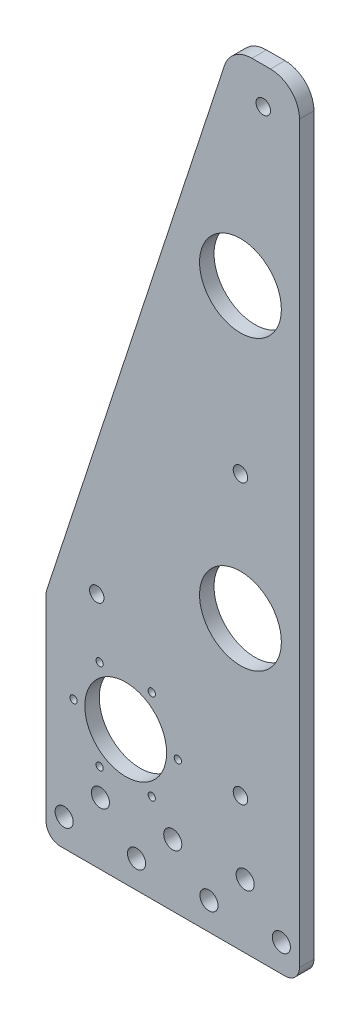
from build123d import *

# Parameters (mm, degrees)
SKETCH1_R           = 14.351
SKETCH1_R_2         = 2.54
SKETCH1_R_3         = 3.175
SKETCH1_R_4         = 1.27
BOSS_EXTRUDE1_DEPTH = 5.08
SKETCH2_R           = 2.54
BOSS_EXTRUDE2_DEPTH = 5.08
SKETCH3_R           = 2.54
CUT_EXTRUDE1_DEPTH  = 288.202574675


with BuildPart() as part:
    # Sketch1 → Boss-Extrude1 (new body)
    with BuildSketch(Plane.XY):
        with BuildLine():
            Line((88.9, 212.09), (88.9, 5.08))
            ThreePointArc((88.9, 5.08), (87.412102448, 1.487897552), (83.82, 0))
            Line((83.82, 0), (5.08, 0))
            ThreePointArc((5.08, 0), (1.487897552, 1.487897552), (0, 5.08))
            Line((0, 5.08), (0, 73.969993162))
            ThreePointArc((0, 73.969993162), (0.063384098, 74.769971217), (0.25195468, 75.549986324))
            Line((0.25195468, 75.549986324), (45.969223296, 215.249986324))
            ThreePointArc((45.969223296, 215.249986324), (49.662087504, 220.315906061), (55.625313935, 222.25))
            Line((55.625313935, 222.25), (78.74, 222.25))
            ThreePointArc((78.74, 222.25), (85.924204897, 219.274204897), (88.9, 212.09))
        make_face()
        with Locations((68.199, 201.93)):
            Circle(SKETCH1_R, mode=Mode.SUBTRACT)
        with Locations((68.199, 100.838)):
            Circle(SKETCH1_R, mode=Mode.SUBTRACT)
        with Locations((68.199, 144.78)):
            Circle(SKETCH1_R_2, mode=Mode.SUBTRACT)
        with Locations((68.199, 46.99)):
            Circle(SKETCH1_R_2, mode=Mode.SUBTRACT)
        with Locations((27.94, 46.99)):
            Circle(SKETCH1_R, mode=Mode.SUBTRACT)
        with Locations((6.35, 9.652)):
            Circle(SKETCH1_R_3, mode=Mode.SUBTRACT)
        with Locations((31.75, 9.652)):
            Circle(SKETCH1_R_3, mode=Mode.SUBTRACT)
        with Locations((57.15, 9.652)):
            Circle(SKETCH1_R_3, mode=Mode.SUBTRACT)
        with Locations((82.55, 9.652)):
            Circle(SKETCH1_R_3, mode=Mode.SUBTRACT)
        with Locations((69.85, 22.352)):
            Circle(SKETCH1_R_3, mode=Mode.SUBTRACT)
        with Locations((44.45, 21.844)):
            Circle(SKETCH1_R_3, mode=Mode.SUBTRACT)
        with Locations((19.05, 21.844)):
            Circle(SKETCH1_R_3, mode=Mode.SUBTRACT)
        with Locations((46.228, 46.99)):
            Circle(SKETCH1_R_4, mode=Mode.SUBTRACT)
        with Locations((37.084, 31.152127416)):
            Circle(SKETCH1_R_4, mode=Mode.SUBTRACT)
        with Locations((18.796, 31.152127416)):
            Circle(SKETCH1_R_4, mode=Mode.SUBTRACT)
        with Locations((9.652, 46.99)):
            Circle(SKETCH1_R_4, mode=Mode.SUBTRACT)
        with Locations((18.796, 62.827872584)):
            Circle(SKETCH1_R_4, mode=Mode.SUBTRACT)
        with Locations((37.084, 62.827872584)):
            Circle(SKETCH1_R_4, mode=Mode.SUBTRACT)
    extrude(amount=BOSS_EXTRUDE1_DEPTH)

    # Sketch2 → Boss-Extrude2 (add)
    with BuildSketch(Plane.XY.offset(5.08)):
        with BuildLine():
            Line((45.969223296, 215.249986324), (62.593684611, 266.049986324))
            ThreePointArc((62.593684611, 266.049986324), (66.286548819, 271.115906061), (72.24977525, 273.05))
            Line((72.24977525, 273.05), (78.74, 273.05))
            ThreePointArc((78.74, 273.05), (85.924204897, 270.074204897), (88.9, 262.89))
            Line((88.9, 262.89), (88.9, 212.09))
            Line((88.9, 212.09), (78.74, 222.25))
            Line((78.74, 222.25), (55.625313935, 222.25))
            Line((55.625313935, 222.25), (45.969223296, 215.249986324))
        make_face()
        with Locations((76.2, 260.35)):
            Circle(SKETCH2_R, mode=Mode.SUBTRACT)
    extrude(amount=-BOSS_EXTRUDE2_DEPTH)

    # Sketch3 → Cut-Extrude1 (cut, through all)
    with BuildSketch(Plane.XY.offset(5.08)):
        with Locations((17.78, 83.058)):
            Circle(SKETCH3_R)
    extrude(amount=-CUT_EXTRUDE1_DEPTH, mode=Mode.SUBTRACT)


solid = part.part
